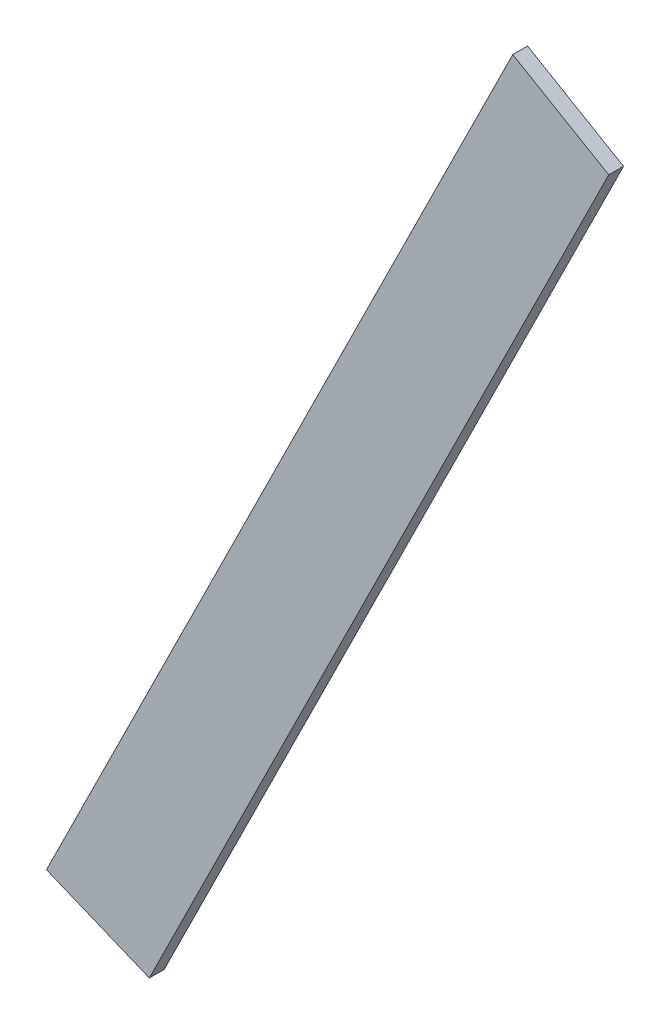
from build123d import *

# Parameters (mm, degrees)
BOSS_EXTRUDE1_DEPTH = 2


with BuildPart() as part:
    # Sketch1 → Boss-Extrude1 (new body)
    with BuildSketch(Plane.XY):
        Polygon((31.437535265, -12.727575135), (17.529963522, -7.008454486), (80.570226072, 119.955965972), (93.544866365, 112.357901677), align=None)
    extrude(amount=BOSS_EXTRUDE1_DEPTH)


solid = part.part
